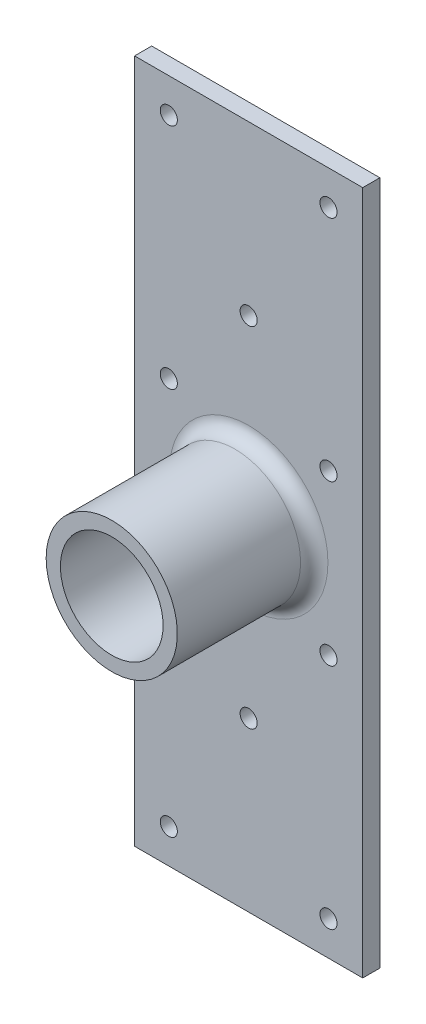
from build123d import *

# Parameters (mm, degrees)
SKETCH1_W                      = 63.5
SKETCH1_H                      = 190.5
BOSS_EXTRUDE1_DEPTH            = 4.7625
SKETCH3_R                      = 6.35
CUT_EXTRUDE1_DEPTH             = 0.508
SKETCH4_R                      = 18.25625
BOSS_EXTRUDE2_DEPTH            = 38.1
SKETCH5_R                      = 12.461875
CUT_EXTRUDE2_DEPTH             = 38.1
SKETCH7_R                      = 14.2875
CUT_EXTRUDE3_DEPTH             = 30.48
FILLET1_R                      = 3.81
F_3_16_0_1875_DIAMETER_HOLE1_D = 4.7625


with BuildPart() as part:
    # Sketch1 → Boss-Extrude1 (new body)
    with BuildSketch(Plane.XY):
        Rectangle(SKETCH1_W, SKETCH1_H)
    extrude(amount=BOSS_EXTRUDE1_DEPTH)

    # Sketch3 → Cut-Extrude1 (cut)
    with BuildSketch(Plane.XY.offset(4.7625)):
        Circle(SKETCH3_R)
    extrude(amount=-CUT_EXTRUDE1_DEPTH, mode=Mode.SUBTRACT)

    # Sketch4 → Boss-Extrude2 (add)
    with BuildSketch(Plane.XY.offset(4.7625)):
        Circle(SKETCH4_R)
    extrude(amount=BOSS_EXTRUDE2_DEPTH)

    # Sketch5 → Cut-Extrude2 (cut)
    with BuildSketch(Plane.XY.offset(42.8625)):
        Circle(SKETCH5_R)
    extrude(amount=-CUT_EXTRUDE2_DEPTH, mode=Mode.SUBTRACT)

    # Sketch7 → Cut-Extrude3 (cut)
    with BuildSketch(Plane.XY.offset(42.8625)):
        Circle(SKETCH7_R)
    extrude(amount=-CUT_EXTRUDE3_DEPTH, mode=Mode.SUBTRACT)

    # Fillet1
    fillet1_edges = [part.edges().sort_by_distance(p)[0] for p in [
        (-18.25625, 0, 4.7625),
    ]]
    fillet(fillet1_edges, radius=FILLET1_R)

    # 3/16 (0.1875) Diameter Hole1 (through all)
    with Locations(Plane.XY.offset(4.7625)):
        with Locations((-22.225, 85.725), (-22.225, -85.725), (22.225, -85.725), (22.225, 85.725), (0, 48.514), (0, -48.514), (-22.225, 22.225), (-22.225, -22.225), (22.225, -22.225), (22.225, 22.225)):
            Hole(F_3_16_0_1875_DIAMETER_HOLE1_D / 2)


solid = part.part
